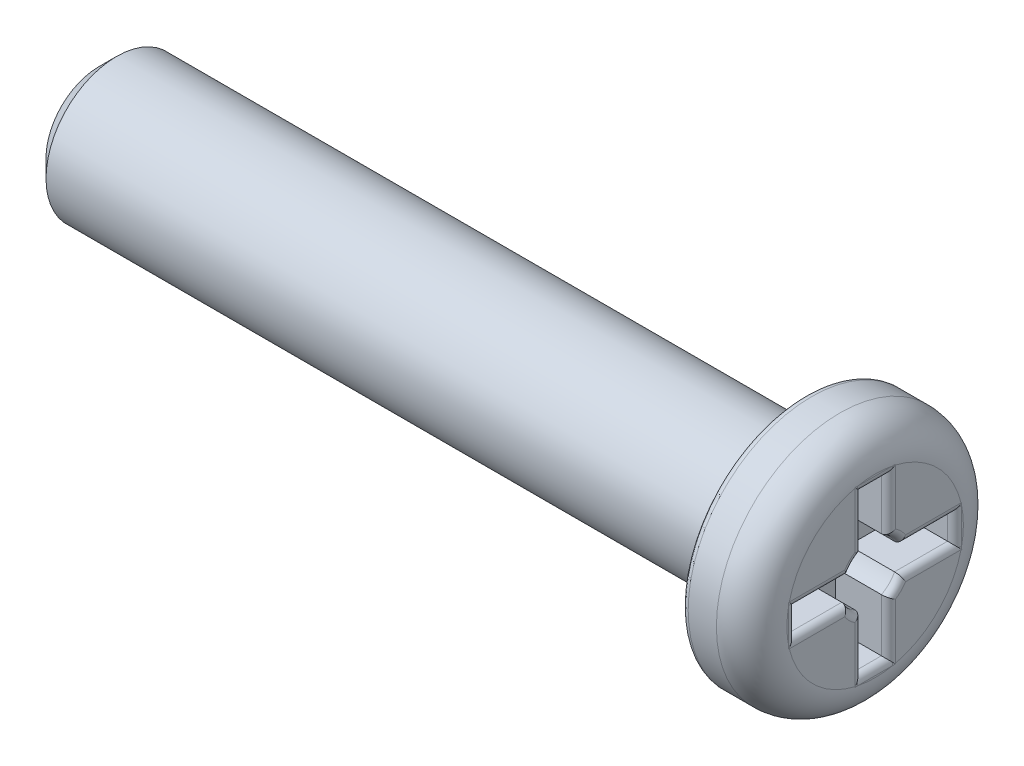
from build123d import *

# Parameters (mm, degrees)
ESQUISSE2_W                  = 0.75
ESQUISSE2_H                  = 2.25
ENL_V_MAT_EXTRU_1_DEPTH      = 1.5
R_P_TITION_CIRCULAIRE1_COUNT = 4
ESQUISSE3_R                  = 0.836492191
ENL_V_MAT_EXTRU_2_DEPTH      = 1.5
CONG_2_R                     = 0.2
CHANFREIN1_SIZE              = 0.5


with BuildPart() as part:
    # Esquisse1 → Révolution1 (revolve)
    with BuildSketch(Plane.XY, mode=Mode.PRIVATE) as r_volution1_sk:
        with BuildLine():
            Line((0, 0), (0, 2))
            Line((0, 2), (20, 2))
            Line((20, 2), (20, 3.5))
            Line((20, 3.5), (21, 3.5))
            ThreePointArc((21, 3.5), (21.707106781, 3.207106781), (22, 2.5))
            Line((22, 2.5), (22, 0))
            Line((22, 0), (0, 0))
        make_face()
    revolve(r_volution1_sk.sketch.rotate(Axis((0, 0, 0), (1, 0, 0)), 90), axis=Axis((0, 0, 0), (1, 0, 0)))

    # Esquisse2 → Enlèv. mat.-Extru.1 (cut)
    with BuildSketch(Plane(origin=(22, 0, 0), x_dir=(0, 0, -1), z_dir=(1, 0, 0))):
        with Locations((0, 1.125)):
            Rectangle(ESQUISSE2_W, ESQUISSE2_H)
    enl_v_mat_extru_1 = extrude(amount=-ENL_V_MAT_EXTRU_1_DEPTH, mode=Mode.SUBTRACT)

    # Répétition circulaire1: Enlèv. mat.-Extru.1 ×4 about axis
    r_p_tition_circulaire1_axis = Axis((0, 0, 0), (1, 0, 0))
    for i in range(1, R_P_TITION_CIRCULAIRE1_COUNT):
        add(enl_v_mat_extru_1.rotate(r_p_tition_circulaire1_axis, i * 360 / R_P_TITION_CIRCULAIRE1_COUNT), mode=Mode.SUBTRACT)

    # Esquisse3 → Enlèv. mat.-Extru.2 (cut)
    with BuildSketch(Plane(origin=(22, 0, 0), x_dir=(0, 0, -1), z_dir=(1, 0, 0))):
        Circle(ESQUISSE3_R)
    extrude(amount=-ENL_V_MAT_EXTRU_2_DEPTH, mode=Mode.SUBTRACT)

    # Congé2
    # the kernel refuses this fillet: 0.2 mm, written as the material it takes off along each edge
    with BuildSketch(Plane(origin=(20, 0, 0), x_dir=(0, 0, 1), z_dir=(0, 1, 0))) as cong_2_piece_1:
        with BuildLine():
            CenterArc((3.5 - CONG_2_R, CONG_2_R), CONG_2_R, 270, 90)
            Line((3.5, CONG_2_R), (3.5 + CONG_2_R * 0.02, CONG_2_R))
            Line((3.5 + CONG_2_R * 0.02, CONG_2_R), (3.5 + CONG_2_R * 0.02, -CONG_2_R * 0.02))
            Line((3.5 + CONG_2_R * 0.02, -CONG_2_R * 0.02), (3.5 - CONG_2_R, -CONG_2_R * 0.02))
            Line((3.5 - CONG_2_R, -CONG_2_R * 0.02), (3.5 - CONG_2_R, 0))
        make_face()
    revolve(axis=Axis((20, 0, 0), (1, 0, 0)), mode=Mode.SUBTRACT)
    with BuildSketch(Plane(origin=(22, -0.375, 2.25), x_dir=(0, 0, 1), z_dir=(0, 1, 0)), Plane(origin=(22, -2.25, -0.375), x_dir=(0, -1, 0), z_dir=(0, 0, 1)), Plane(origin=(22, 0.375, -2.25), x_dir=(0, 0, -1), z_dir=(0, -1, 0)), Plane(origin=(22, 2.25, 0.375), x_dir=(0, 1, 0), z_dir=(0, 0, -1))) as cong_2_piece_2:
        with BuildLine():
            CenterArc((CONG_2_R, -CONG_2_R), CONG_2_R, 90, 90)
            Line((0, -CONG_2_R), (-CONG_2_R * 0.02, -CONG_2_R))
            Line((-CONG_2_R * 0.02, -CONG_2_R), (-CONG_2_R * 0.02, CONG_2_R * 0.02))
            Line((-CONG_2_R * 0.02, CONG_2_R * 0.02), (CONG_2_R, CONG_2_R * 0.02))
            Line((CONG_2_R, CONG_2_R * 0.02), (CONG_2_R, 0))
        make_face()
    extrude(amount=0.75, mode=Mode.SUBTRACT)
    with BuildSketch(Plane(origin=(22, -0.375, 0.24772601), x_dir=(0, -1, 0), z_dir=(0, 0, 1)), Plane(origin=(22, -2.25, 0.375), x_dir=(0, 0, 1), z_dir=(0, 1, 0)), Plane(origin=(22, -0.24772601, -0.375), x_dir=(0, 0, -1), z_dir=(0, -1, 0)), Plane(origin=(22, -0.375, -2.25), x_dir=(0, -1, 0), z_dir=(0, 0, 1)), Plane(origin=(22, 0.375, -0.24772601), x_dir=(0, 1, 0), z_dir=(0, 0, -1)), Plane(origin=(22, 2.25, -0.375), x_dir=(0, 0, -1), z_dir=(0, -1, 0)), Plane(origin=(22, 0.24772601, 0.375), x_dir=(0, 0, 1), z_dir=(0, 1, 0)), Plane(origin=(22, 0.375, 2.25), x_dir=(0, 1, 0), z_dir=(0, 0, -1))) as cong_2_piece_3:
        with BuildLine():
            CenterArc((CONG_2_R, -CONG_2_R), CONG_2_R, 90, 90)
            Line((0, -CONG_2_R), (-CONG_2_R * 0.02, -CONG_2_R))
            Line((-CONG_2_R * 0.02, -CONG_2_R), (-CONG_2_R * 0.02, CONG_2_R * 0.02))
            Line((-CONG_2_R * 0.02, CONG_2_R * 0.02), (CONG_2_R, CONG_2_R * 0.02))
            Line((CONG_2_R, CONG_2_R * 0.02), (CONG_2_R, 0))
        make_face()
    extrude(amount=2.00227399, mode=Mode.SUBTRACT)
    with BuildSketch(Plane(origin=(22, 0, 0), x_dir=(0, 0.13251987061170517, 0.9911803488230871), z_dir=(0, 0.9911803488230871, -0.13251987061170517))) as cong_2_piece_4:
        with BuildLine():
            CenterArc((0.836492191 + CONG_2_R, -CONG_2_R), CONG_2_R, 90, 90)
            Line((0.836492191, -CONG_2_R), (0.836492191 - CONG_2_R * 0.02, -CONG_2_R))
            Line((0.836492191 - CONG_2_R * 0.02, -CONG_2_R), (0.836492191 - CONG_2_R * 0.02, CONG_2_R * 0.02))
            Line((0.836492191 - CONG_2_R * 0.02, CONG_2_R * 0.02), (0.836492191 + CONG_2_R, CONG_2_R * 0.02))
            Line((0.836492191 + CONG_2_R, CONG_2_R * 0.02), (0.836492191 + CONG_2_R, 0))
        make_face()
    revolve(axis=Axis((22, 0, 0), (1, 0, 0)), revolution_arc=105.230460742, mode=Mode.SUBTRACT)
    with BuildSketch(Plane(origin=(22, 0, 0), x_dir=(0, -0.9911803488230848, 0.1325198706117237), z_dir=(0, 0.1325198706117237, 0.9911803488230848))) as cong_2_piece_5:
        with BuildLine():
            CenterArc((0.836492191 + CONG_2_R, -CONG_2_R), CONG_2_R, 90, 90)
            Line((0.836492191, -CONG_2_R), (0.836492191 - CONG_2_R * 0.02, -CONG_2_R))
            Line((0.836492191 - CONG_2_R * 0.02, -CONG_2_R), (0.836492191 - CONG_2_R * 0.02, CONG_2_R * 0.02))
            Line((0.836492191 - CONG_2_R * 0.02, CONG_2_R * 0.02), (0.836492191 + CONG_2_R, CONG_2_R * 0.02))
            Line((0.836492191 + CONG_2_R, CONG_2_R * 0.02), (0.836492191 + CONG_2_R, 0))
        make_face()
    revolve(axis=Axis((22, 0, 0), (1, 0, 0)), revolution_arc=105.230460742, mode=Mode.SUBTRACT)
    with BuildSketch(Plane(origin=(22, 0, 0), x_dir=(0, -0.13251987061172962, -0.991180348823084), z_dir=(0, -0.991180348823084, 0.13251987061172962))) as cong_2_piece_6:
        with BuildLine():
            CenterArc((0.836492191 + CONG_2_R, -CONG_2_R), CONG_2_R, 90, 90)
            Line((0.836492191, -CONG_2_R), (0.836492191 - CONG_2_R * 0.02, -CONG_2_R))
            Line((0.836492191 - CONG_2_R * 0.02, -CONG_2_R), (0.836492191 - CONG_2_R * 0.02, CONG_2_R * 0.02))
            Line((0.836492191 - CONG_2_R * 0.02, CONG_2_R * 0.02), (0.836492191 + CONG_2_R, CONG_2_R * 0.02))
            Line((0.836492191 + CONG_2_R, CONG_2_R * 0.02), (0.836492191 + CONG_2_R, 0))
        make_face()
    revolve(axis=Axis((22, 0, 0), (1, 0, 0)), revolution_arc=105.230460742, mode=Mode.SUBTRACT)
    with BuildSketch(Plane(origin=(22, 0, 0), x_dir=(0, 0.9911803488230839, -0.13251987061173062), z_dir=(0, -0.13251987061173062, -0.9911803488230839))) as cong_2_piece_7:
        with BuildLine():
            CenterArc((0.836492191 + CONG_2_R, -CONG_2_R), CONG_2_R, 90, 90)
            Line((0.836492191, -CONG_2_R), (0.836492191 - CONG_2_R * 0.02, -CONG_2_R))
            Line((0.836492191 - CONG_2_R * 0.02, -CONG_2_R), (0.836492191 - CONG_2_R * 0.02, CONG_2_R * 0.02))
            Line((0.836492191 - CONG_2_R * 0.02, CONG_2_R * 0.02), (0.836492191 + CONG_2_R, CONG_2_R * 0.02))
            Line((0.836492191 + CONG_2_R, CONG_2_R * 0.02), (0.836492191 + CONG_2_R, 0))
        make_face()
    revolve(axis=Axis((22, 0, 0), (1, 0, 0)), revolution_arc=105.230460742, mode=Mode.SUBTRACT)
    with BuildSketch(Plane(origin=(22, -0.875, 2.25), x_dir=(0, 0, 1), z_dir=(0, 1, 0))) as cong_2_piece_8a_section:
        with BuildLine():
            CenterArc((CONG_2_R, -CONG_2_R), CONG_2_R, 90, 90)
            Line((0, -CONG_2_R), (-CONG_2_R * 0.02, -CONG_2_R))
            Line((-CONG_2_R * 0.02, -CONG_2_R), (-CONG_2_R * 0.02, CONG_2_R * 0.02))
            Line((-CONG_2_R * 0.02, CONG_2_R * 0.02), (CONG_2_R, CONG_2_R * 0.02))
            Line((CONG_2_R, CONG_2_R * 0.02), (CONG_2_R, 0))
        make_face()
    cong_2_piece_8a = extrude(amount=1.25, mode=Mode.PRIVATE)
    cong_2_piece_8a = split(cong_2_piece_8a, bisect_by=Plane(origin=(21.954720977, -0.375, 2.295279023), z_dir=(0, -1, 0)), keep=Keep.TOP, mode=Mode.PRIVATE)
    with BuildSketch(Plane(origin=(22, -0.375, 0.24772601), x_dir=(0, -1, 0), z_dir=(0, 0, 1))) as cong_2_piece_8b_section:
        with BuildLine():
            CenterArc((CONG_2_R, -CONG_2_R), CONG_2_R, 90, 90)
            Line((0, -CONG_2_R), (-CONG_2_R * 0.02, -CONG_2_R))
            Line((-CONG_2_R * 0.02, -CONG_2_R), (-CONG_2_R * 0.02, CONG_2_R * 0.02))
            Line((-CONG_2_R * 0.02, CONG_2_R * 0.02), (CONG_2_R, CONG_2_R * 0.02))
            Line((CONG_2_R, CONG_2_R * 0.02), (CONG_2_R, 0))
        make_face()
    cong_2_piece_8b = extrude(amount=2.50227399, mode=Mode.PRIVATE)
    cong_2_piece_8b = split(cong_2_piece_8b, bisect_by=Plane(origin=(21.954720977, -0.420279023, 2.25), z_dir=(0, 0, 1)), keep=Keep.TOP, mode=Mode.PRIVATE)
    cong_2_piece_8 = cong_2_piece_8a & cong_2_piece_8b
    add(cong_2_piece_8, mode=Mode.SUBTRACT)
    with BuildSketch(Plane(origin=(22, -0.375, 2.25), x_dir=(0, 0, 1), z_dir=(0, 1, 0))) as cong_2_piece_9a_section:
        with BuildLine():
            CenterArc((CONG_2_R, -CONG_2_R), CONG_2_R, 90, 90)
            Line((0, -CONG_2_R), (-CONG_2_R * 0.02, -CONG_2_R))
            Line((-CONG_2_R * 0.02, -CONG_2_R), (-CONG_2_R * 0.02, CONG_2_R * 0.02))
            Line((-CONG_2_R * 0.02, CONG_2_R * 0.02), (CONG_2_R, CONG_2_R * 0.02))
            Line((CONG_2_R, CONG_2_R * 0.02), (CONG_2_R, 0))
        make_face()
    cong_2_piece_9a = extrude(amount=1.25, mode=Mode.PRIVATE)
    cong_2_piece_9a = split(cong_2_piece_9a, bisect_by=Plane(origin=(21.954720977, 0.375, 2.295279023), z_dir=(0, 1, 0)), keep=Keep.TOP, mode=Mode.PRIVATE)
    with BuildSketch(Plane(origin=(22, 0.375, 2.75), x_dir=(0, 1, 0), z_dir=(0, 0, -1))) as cong_2_piece_9b_section:
        with BuildLine():
            CenterArc((CONG_2_R, -CONG_2_R), CONG_2_R, 90, 90)
            Line((0, -CONG_2_R), (-CONG_2_R * 0.02, -CONG_2_R))
            Line((-CONG_2_R * 0.02, -CONG_2_R), (-CONG_2_R * 0.02, CONG_2_R * 0.02))
            Line((-CONG_2_R * 0.02, CONG_2_R * 0.02), (CONG_2_R, CONG_2_R * 0.02))
            Line((CONG_2_R, CONG_2_R * 0.02), (CONG_2_R, 0))
        make_face()
    cong_2_piece_9b = extrude(amount=2.50227399, mode=Mode.PRIVATE)
    cong_2_piece_9b = split(cong_2_piece_9b, bisect_by=Plane(origin=(21.954720977, 0.420279023, 2.25), z_dir=(0, 0, 1)), keep=Keep.TOP, mode=Mode.PRIVATE)
    cong_2_piece_9 = cong_2_piece_9a & cong_2_piece_9b
    add(cong_2_piece_9, mode=Mode.SUBTRACT)
    with BuildSketch(Plane(origin=(22, -2.75, 0.375), x_dir=(0, 0, 1), z_dir=(0, 1, 0))) as cong_2_piece_10a_section:
        with BuildLine():
            CenterArc((CONG_2_R, -CONG_2_R), CONG_2_R, 90, 90)
            Line((0, -CONG_2_R), (-CONG_2_R * 0.02, -CONG_2_R))
            Line((-CONG_2_R * 0.02, -CONG_2_R), (-CONG_2_R * 0.02, CONG_2_R * 0.02))
            Line((-CONG_2_R * 0.02, CONG_2_R * 0.02), (CONG_2_R, CONG_2_R * 0.02))
            Line((CONG_2_R, CONG_2_R * 0.02), (CONG_2_R, 0))
        make_face()
    cong_2_piece_10a = extrude(amount=2.50227399, mode=Mode.PRIVATE)
    cong_2_piece_10a = split(cong_2_piece_10a, bisect_by=Plane(origin=(21.954720977, -2.25, 0.420279023), z_dir=(0, -1, 0)), keep=Keep.TOP, mode=Mode.PRIVATE)
    with BuildSketch(Plane(origin=(22, -2.25, -0.375), x_dir=(0, -1, 0), z_dir=(0, 0, 1))) as cong_2_piece_10b_section:
        with BuildLine():
            CenterArc((CONG_2_R, -CONG_2_R), CONG_2_R, 90, 90)
            Line((0, -CONG_2_R), (-CONG_2_R * 0.02, -CONG_2_R))
            Line((-CONG_2_R * 0.02, -CONG_2_R), (-CONG_2_R * 0.02, CONG_2_R * 0.02))
            Line((-CONG_2_R * 0.02, CONG_2_R * 0.02), (CONG_2_R, CONG_2_R * 0.02))
            Line((CONG_2_R, CONG_2_R * 0.02), (CONG_2_R, 0))
        make_face()
    cong_2_piece_10b = extrude(amount=1.25, mode=Mode.PRIVATE)
    cong_2_piece_10b = split(cong_2_piece_10b, bisect_by=Plane(origin=(21.954720977, -2.295279023, 0.375), z_dir=(0, 0, 1)), keep=Keep.TOP, mode=Mode.PRIVATE)
    cong_2_piece_10 = cong_2_piece_10a & cong_2_piece_10b
    add(cong_2_piece_10, mode=Mode.SUBTRACT)
    with BuildSketch(Plane(origin=(22, -2.25, -0.875), x_dir=(0, -1, 0), z_dir=(0, 0, 1))) as cong_2_piece_11a_section:
        with BuildLine():
            CenterArc((CONG_2_R, -CONG_2_R), CONG_2_R, 90, 90)
            Line((0, -CONG_2_R), (-CONG_2_R * 0.02, -CONG_2_R))
            Line((-CONG_2_R * 0.02, -CONG_2_R), (-CONG_2_R * 0.02, CONG_2_R * 0.02))
            Line((-CONG_2_R * 0.02, CONG_2_R * 0.02), (CONG_2_R, CONG_2_R * 0.02))
            Line((CONG_2_R, CONG_2_R * 0.02), (CONG_2_R, 0))
        make_face()
    cong_2_piece_11a = extrude(amount=1.25, mode=Mode.PRIVATE)
    cong_2_piece_11a = split(cong_2_piece_11a, bisect_by=Plane(origin=(21.954720977, -2.295279023, -0.375), z_dir=(0, 0, -1)), keep=Keep.TOP, mode=Mode.PRIVATE)
    with BuildSketch(Plane(origin=(22, -0.24772601, -0.375), x_dir=(0, 0, -1), z_dir=(0, -1, 0))) as cong_2_piece_11b_section:
        with BuildLine():
            CenterArc((CONG_2_R, -CONG_2_R), CONG_2_R, 90, 90)
            Line((0, -CONG_2_R), (-CONG_2_R * 0.02, -CONG_2_R))
            Line((-CONG_2_R * 0.02, -CONG_2_R), (-CONG_2_R * 0.02, CONG_2_R * 0.02))
            Line((-CONG_2_R * 0.02, CONG_2_R * 0.02), (CONG_2_R, CONG_2_R * 0.02))
            Line((CONG_2_R, CONG_2_R * 0.02), (CONG_2_R, 0))
        make_face()
    cong_2_piece_11b = extrude(amount=2.50227399, mode=Mode.PRIVATE)
    cong_2_piece_11b = split(cong_2_piece_11b, bisect_by=Plane(origin=(21.954720977, -2.25, -0.420279023), z_dir=(0, -1, 0)), keep=Keep.TOP, mode=Mode.PRIVATE)
    cong_2_piece_11 = cong_2_piece_11a & cong_2_piece_11b
    add(cong_2_piece_11, mode=Mode.SUBTRACT)
    with BuildSketch(Plane(origin=(22, -0.375, -2.75), x_dir=(0, -1, 0), z_dir=(0, 0, 1))) as cong_2_piece_12a_section:
        with BuildLine():
            CenterArc((CONG_2_R, -CONG_2_R), CONG_2_R, 90, 90)
            Line((0, -CONG_2_R), (-CONG_2_R * 0.02, -CONG_2_R))
            Line((-CONG_2_R * 0.02, -CONG_2_R), (-CONG_2_R * 0.02, CONG_2_R * 0.02))
            Line((-CONG_2_R * 0.02, CONG_2_R * 0.02), (CONG_2_R, CONG_2_R * 0.02))
            Line((CONG_2_R, CONG_2_R * 0.02), (CONG_2_R, 0))
        make_face()
    cong_2_piece_12a = extrude(amount=2.50227399, mode=Mode.PRIVATE)
    cong_2_piece_12a = split(cong_2_piece_12a, bisect_by=Plane(origin=(21.954720977, -0.420279023, -2.25), z_dir=(0, 0, -1)), keep=Keep.TOP, mode=Mode.PRIVATE)
    with BuildSketch(Plane(origin=(22, 0.375, -2.25), x_dir=(0, 0, -1), z_dir=(0, -1, 0))) as cong_2_piece_12b_section:
        with BuildLine():
            CenterArc((CONG_2_R, -CONG_2_R), CONG_2_R, 90, 90)
            Line((0, -CONG_2_R), (-CONG_2_R * 0.02, -CONG_2_R))
            Line((-CONG_2_R * 0.02, -CONG_2_R), (-CONG_2_R * 0.02, CONG_2_R * 0.02))
            Line((-CONG_2_R * 0.02, CONG_2_R * 0.02), (CONG_2_R, CONG_2_R * 0.02))
            Line((CONG_2_R, CONG_2_R * 0.02), (CONG_2_R, 0))
        make_face()
    cong_2_piece_12b = extrude(amount=1.25, mode=Mode.PRIVATE)
    cong_2_piece_12b = split(cong_2_piece_12b, bisect_by=Plane(origin=(21.954720977, -0.375, -2.295279023), z_dir=(0, -1, 0)), keep=Keep.TOP, mode=Mode.PRIVATE)
    cong_2_piece_12 = cong_2_piece_12a & cong_2_piece_12b
    add(cong_2_piece_12, mode=Mode.SUBTRACT)
    with BuildSketch(Plane(origin=(22, 0.875, -2.25), x_dir=(0, 0, -1), z_dir=(0, -1, 0))) as cong_2_piece_13a_section:
        with BuildLine():
            CenterArc((CONG_2_R, -CONG_2_R), CONG_2_R, 90, 90)
            Line((0, -CONG_2_R), (-CONG_2_R * 0.02, -CONG_2_R))
            Line((-CONG_2_R * 0.02, -CONG_2_R), (-CONG_2_R * 0.02, CONG_2_R * 0.02))
            Line((-CONG_2_R * 0.02, CONG_2_R * 0.02), (CONG_2_R, CONG_2_R * 0.02))
            Line((CONG_2_R, CONG_2_R * 0.02), (CONG_2_R, 0))
        make_face()
    cong_2_piece_13a = extrude(amount=1.25, mode=Mode.PRIVATE)
    cong_2_piece_13a = split(cong_2_piece_13a, bisect_by=Plane(origin=(21.954720977, 0.375, -2.295279023), z_dir=(0, 1, 0)), keep=Keep.TOP, mode=Mode.PRIVATE)
    with BuildSketch(Plane(origin=(22, 0.375, -0.24772601), x_dir=(0, 1, 0), z_dir=(0, 0, -1))) as cong_2_piece_13b_section:
        with BuildLine():
            CenterArc((CONG_2_R, -CONG_2_R), CONG_2_R, 90, 90)
            Line((0, -CONG_2_R), (-CONG_2_R * 0.02, -CONG_2_R))
            Line((-CONG_2_R * 0.02, -CONG_2_R), (-CONG_2_R * 0.02, CONG_2_R * 0.02))
            Line((-CONG_2_R * 0.02, CONG_2_R * 0.02), (CONG_2_R, CONG_2_R * 0.02))
            Line((CONG_2_R, CONG_2_R * 0.02), (CONG_2_R, 0))
        make_face()
    cong_2_piece_13b = extrude(amount=2.50227399, mode=Mode.PRIVATE)
    cong_2_piece_13b = split(cong_2_piece_13b, bisect_by=Plane(origin=(21.954720977, 0.420279023, -2.25), z_dir=(0, 0, -1)), keep=Keep.TOP, mode=Mode.PRIVATE)
    cong_2_piece_13 = cong_2_piece_13a & cong_2_piece_13b
    add(cong_2_piece_13, mode=Mode.SUBTRACT)
    with BuildSketch(Plane(origin=(22, 2.75, -0.375), x_dir=(0, 0, -1), z_dir=(0, -1, 0))) as cong_2_piece_14a_section:
        with BuildLine():
            CenterArc((CONG_2_R, -CONG_2_R), CONG_2_R, 90, 90)
            Line((0, -CONG_2_R), (-CONG_2_R * 0.02, -CONG_2_R))
            Line((-CONG_2_R * 0.02, -CONG_2_R), (-CONG_2_R * 0.02, CONG_2_R * 0.02))
            Line((-CONG_2_R * 0.02, CONG_2_R * 0.02), (CONG_2_R, CONG_2_R * 0.02))
            Line((CONG_2_R, CONG_2_R * 0.02), (CONG_2_R, 0))
        make_face()
    cong_2_piece_14a = extrude(amount=2.50227399, mode=Mode.PRIVATE)
    cong_2_piece_14a = split(cong_2_piece_14a, bisect_by=Plane(origin=(21.954720977, 2.25, -0.420279023), z_dir=(0, 1, 0)), keep=Keep.TOP, mode=Mode.PRIVATE)
    with BuildSketch(Plane(origin=(22, 2.25, 0.375), x_dir=(0, 1, 0), z_dir=(0, 0, -1))) as cong_2_piece_14b_section:
        with BuildLine():
            CenterArc((CONG_2_R, -CONG_2_R), CONG_2_R, 90, 90)
            Line((0, -CONG_2_R), (-CONG_2_R * 0.02, -CONG_2_R))
            Line((-CONG_2_R * 0.02, -CONG_2_R), (-CONG_2_R * 0.02, CONG_2_R * 0.02))
            Line((-CONG_2_R * 0.02, CONG_2_R * 0.02), (CONG_2_R, CONG_2_R * 0.02))
            Line((CONG_2_R, CONG_2_R * 0.02), (CONG_2_R, 0))
        make_face()
    cong_2_piece_14b = extrude(amount=1.25, mode=Mode.PRIVATE)
    cong_2_piece_14b = split(cong_2_piece_14b, bisect_by=Plane(origin=(21.954720977, 2.295279023, -0.375), z_dir=(0, 0, -1)), keep=Keep.TOP, mode=Mode.PRIVATE)
    cong_2_piece_14 = cong_2_piece_14a & cong_2_piece_14b
    add(cong_2_piece_14, mode=Mode.SUBTRACT)
    with BuildSketch(Plane(origin=(22, 2.25, 0.875), x_dir=(0, 1, 0), z_dir=(0, 0, -1))) as cong_2_piece_15a_section:
        with BuildLine():
            CenterArc((CONG_2_R, -CONG_2_R), CONG_2_R, 90, 90)
            Line((0, -CONG_2_R), (-CONG_2_R * 0.02, -CONG_2_R))
            Line((-CONG_2_R * 0.02, -CONG_2_R), (-CONG_2_R * 0.02, CONG_2_R * 0.02))
            Line((-CONG_2_R * 0.02, CONG_2_R * 0.02), (CONG_2_R, CONG_2_R * 0.02))
            Line((CONG_2_R, CONG_2_R * 0.02), (CONG_2_R, 0))
        make_face()
    cong_2_piece_15a = extrude(amount=1.25, mode=Mode.PRIVATE)
    cong_2_piece_15a = split(cong_2_piece_15a, bisect_by=Plane(origin=(21.954720977, 2.295279023, 0.375), z_dir=(0, 0, 1)), keep=Keep.TOP, mode=Mode.PRIVATE)
    with BuildSketch(Plane(origin=(22, 0.24772601, 0.375), x_dir=(0, 0, 1), z_dir=(0, 1, 0))) as cong_2_piece_15b_section:
        with BuildLine():
            CenterArc((CONG_2_R, -CONG_2_R), CONG_2_R, 90, 90)
            Line((0, -CONG_2_R), (-CONG_2_R * 0.02, -CONG_2_R))
            Line((-CONG_2_R * 0.02, -CONG_2_R), (-CONG_2_R * 0.02, CONG_2_R * 0.02))
            Line((-CONG_2_R * 0.02, CONG_2_R * 0.02), (CONG_2_R, CONG_2_R * 0.02))
            Line((CONG_2_R, CONG_2_R * 0.02), (CONG_2_R, 0))
        make_face()
    cong_2_piece_15b = extrude(amount=2.50227399, mode=Mode.PRIVATE)
    cong_2_piece_15b = split(cong_2_piece_15b, bisect_by=Plane(origin=(21.954720977, 2.25, 0.420279023), z_dir=(0, 1, 0)), keep=Keep.TOP, mode=Mode.PRIVATE)
    cong_2_piece_15 = cong_2_piece_15a & cong_2_piece_15b
    add(cong_2_piece_15, mode=Mode.SUBTRACT)

    # Chanfrein1
    chanfrein1_edges = [part.edges().sort_by_distance(p)[0] for p in [
        (0, 0, -2),
    ]]
    chamfer(chanfrein1_edges, length=CHANFREIN1_SIZE)


solid = part.part
